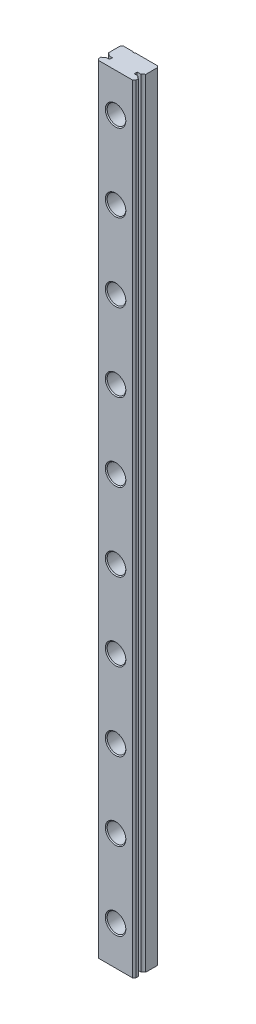
from build123d import *

# Parameters (mm, degrees)
DELKA_DEPTH       = 250
D_RA1_D           = 3.5
D_RA1_CBORE_D     = 6
D_RA1_CBORE_DEPTH = 4.5
LINPOLE1_COUNT    = 10
LINPOLE1_PITCH    = 25


with BuildPart() as part:
    # Skica1 → Delka (new body)
    with BuildSketch(Plane(origin=(0, 0, 0), x_dir=(1, 0, 0), z_dir=(0, 1, 0))):
        with BuildLine():
            Line((-5.5, -8), (5.5, -8))
            Line((5.5, -8), (6, -7.5))
            Line((6, -7.5), (6, -6.661895004))
            ThreePointArc((6, -6.661895004), (5.52983318, -6.420240767), (5.209128789, -6))
            Line((5.209128789, -6), (4, -5.95))
            Line((4, -5.95), (4, -5.05))
            Line((4, -5.05), (5.209128789, -5))
            ThreePointArc((5.209128789, -5), (5.52983318, -4.579759233), (6, -4.338104996))
            Line((6, -4.338104996), (6, -0.5))
            Line((6, -0.5), (5.5, 0))
            Line((5.5, 0), (-1.6, 0))
            ThreePointArc((-1.6, 0), (-2, -0.2), (-2.4, 0))
            Line((-2.4, 0), (-5.5, 0))
            Line((-5.5, 0), (-6, -0.5))
            Line((-6, -0.5), (-6, -4.338104996))
            ThreePointArc((-6, -4.338104996), (-5.52983318, -4.579759233), (-5.209128789, -5))
            Line((-5.209128789, -5), (-4, -5.05))
            Line((-4, -5.05), (-4, -5.95))
            Line((-4, -5.95), (-5.209128789, -6))
            ThreePointArc((-5.209128789, -6), (-5.52983318, -6.420240767), (-6, -6.661895004))
            Line((-6, -6.661895004), (-6, -7.5))
            Line((-6, -7.5), (-5.5, -8))
        make_face()
    extrude(amount=DELKA_DEPTH)

    # Díra1 (through all)
    with Locations(Plane.XY.offset(8)):
        with Locations((0, 12.5)):
            d_ra1 = CounterBoreHole(D_RA1_D / 2, D_RA1_CBORE_D / 2, D_RA1_CBORE_DEPTH)

    # Zkosení1: read off the stored shape, not the designer's step
    # Zkosení1 outline → Zkosení1 (revolve, cut)
    with BuildSketch(Plane.XZ.offset(-12.5)):
        Polygon((2.050001495, -1.495e-06), (1.75, 0.3), (1.75, -1.495e-06), align=None)
        Polygon((3, 8), (3, 7.7), (3.3, 8), align=None)
    zkosen_1 = revolve(axis=Axis((0, 12.5, 0), (0, 0, 1)), mode=Mode.SUBTRACT)

    # LinPole1: Díra1, Zkosení1 ×10
    with Locations(*[(0, i * LINPOLE1_PITCH, 0) for i in range(1, LINPOLE1_COUNT)]):
        add(d_ra1, mode=Mode.SUBTRACT)
        add(zkosen_1, mode=Mode.SUBTRACT)


solid = part.part
